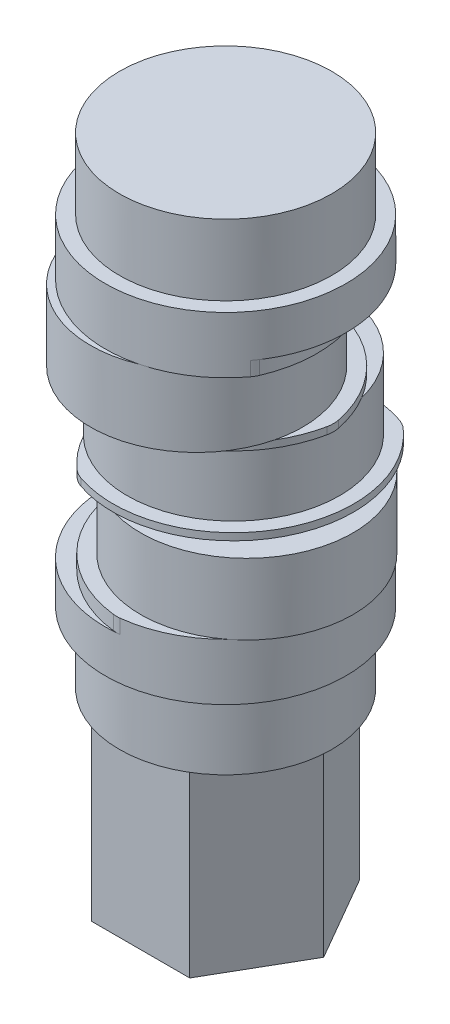
from build123d import *
from build123d.topology import SkipClean

# Parameters (mm, degrees)
BOSS_EXTRUDE1_DEPTH  = 13
SKETCH5_R            = 7.5
BOSS_EXTRUDE2_DEPTH  = 8
BOSS_EXTRUDE3_DEPTH  = 1
SKETCH7_R            = 7.5
BOSS_EXTRUDE4_DEPTH  = 5
BOSS_EXTRUDE5_DEPTH  = 0.5
SKETCH9_R            = 7.5
BOSS_EXTRUDE6_DEPTH  = 5
BOSS_EXTRUDE7_DEPTH  = 0.5
SKETCH12_R           = 7.5
BOSS_EXTRUDE8_DEPTH  = 5
BOSS_EXTRUDE9_DEPTH  = 1
SKETCH14_R           = 7.5
BOSS_EXTRUDE10_DEPTH = 8
FILLET1_R            = 2
BOSS_EXTRUDE11_START = 3
SKETCH15_R           = 8.5
BOSS_EXTRUDE11_DEPTH = 3
SKETCH16_R           = 8.5
BOSS_EXTRUDE12_DEPTH = 3


with BuildPart() as part:
    # Sketch4 → Boss-Extrude1 (new body)
    with BuildSketch(Plane(origin=(0, 0, 0), x_dir=(1, 0, 0), z_dir=(0, 1, 0))):
        Polygon((-3.464101615, 6), (-6.92820323, 0), (-3.464101615, -6), (3.464101615, -6), (6.92820323, 0), (3.464101615, 6), align=None)
    extrude(amount=BOSS_EXTRUDE1_DEPTH)

    # Sketch5 → Boss-Extrude2 (add)
    with BuildSketch(Plane(origin=(0, 13, 0), x_dir=(1, 0, 0), z_dir=(0, 1, 0))):
        Circle(SKETCH5_R)
    extrude(amount=BOSS_EXTRUDE2_DEPTH)

    # Sketch6 → Boss-Extrude3 (add)
    with BuildSketch(Plane(origin=(0, 21, 0), x_dir=(1, 0, 0), z_dir=(0, 1, 0))):
        with BuildLine():
            ThreePointArc((0.75, -8.466847111), (8.5, 0), (0.75, 8.466847111))
            ThreePointArc((0.75, 8.466847111), (-7, 0), (0.75, -8.466847111))
        make_face()
    extrude(amount=BOSS_EXTRUDE3_DEPTH)

    # Sketch7 → Boss-Extrude4 (add)
    with BuildSketch(Plane(origin=(0, 22, 0), x_dir=(1, 0, 0), z_dir=(0, 1, 0))):
        with Locations((1.5, 0)):
            Circle(SKETCH7_R)
    extrude(amount=BOSS_EXTRUDE4_DEPTH)

    # Sketch8 → Boss-Extrude5 (add)
    with BuildSketch(Plane(origin=(0, 27, 0), x_dir=(1, 0, 0), z_dir=(0, 1, 0))):
        with BuildLine():
            ThreePointArc((4.575074404, 7.924261316), (-5.861215932, 4.25), (-3.825074404, -6.625223211))
            ThreePointArc((-3.825074404, -6.625223211), (6.611215932, -2.950961894), (4.575074404, 7.924261316))
        make_face()
    extrude(amount=BOSS_EXTRUDE5_DEPTH)

    # Sketch9 → Boss-Extrude6 (add)
    with BuildSketch(Plane(origin=(0, 27.5, 0), x_dir=(1, 0, 0), z_dir=(0, 1, 0))):
        with Locations((-0.75, 1.299038106)):
            Circle(SKETCH9_R)
    extrude(amount=BOSS_EXTRUDE6_DEPTH)

    # Sketch11 → Boss-Extrude7 (add)
    with BuildSketch(Plane(origin=(0, 32.5, 0), x_dir=(1, 0, 0), z_dir=(0, 1, 0))):
        with BuildLine():
            ThreePointArc((-9.150148808, 0), (-0.75, -7.200961894), (7.650148808, 0))
            ThreePointArc((7.650148808, 0), (-0.75, 7.200961894), (-9.150148808, 0))
        make_face()
    extrude(amount=BOSS_EXTRUDE7_DEPTH)

    # Sketch12 → Boss-Extrude8 (add)
    with BuildSketch(Plane(origin=(0, 33, 0), x_dir=(1, 0, 0), z_dir=(0, 1, 0))):
        with Locations((-0.75, -1.299038106)):
            Circle(SKETCH12_R)
    extrude(amount=BOSS_EXTRUDE8_DEPTH)

    # Sketch13 → Boss-Extrude9 (add)
    with BuildSketch(Plane(origin=(0, 38, 0), x_dir=(1, 0, 0), z_dir=(0, 1, 0))):
        with BuildLine():
            ThreePointArc((6.957504688, -4.882942608), (3.5, 6.062177826), (-7.707504688, 3.583904503))
            ThreePointArc((-7.707504688, 3.583904503), (-4.25, -7.361215932), (6.957504688, -4.882942608))
        make_face()
    extrude(amount=BOSS_EXTRUDE9_DEPTH)

    # Sketch14 → Boss-Extrude10 (add)
    with BuildSketch(Plane(origin=(0, 39, 0), x_dir=(1, 0, 0), z_dir=(0, 1, 0))):
        Circle(SKETCH14_R)
    extrude(amount=BOSS_EXTRUDE10_DEPTH)

    # Fillet1
    fillet1_edges = [part.edges().sort_by_distance(p)[0] for p in [
        (0.75, 21.5, -8.466847111),
        (0.75, 21.5, 8.466847111),
        (-3.825074404, 27.25, 6.625223211),
        (4.575074404, 27.25, -7.924261316),
        (7.650148808, 32.75, 0),
        (-9.150148808, 32.75, 0),
        (-7.707504688, 38.5, -3.583904503),
        (6.957504688, 38.5, 4.882942608),
    ]]
    fillet(fillet1_edges, radius=FILLET1_R)

    # Sketch15 → Boss-Extrude11 (add)
    with BuildSketch(Plane.XZ.offset(-21).offset(BOSS_EXTRUDE11_START)):
        Circle(SKETCH15_R)
    extrude(amount=-BOSS_EXTRUDE11_DEPTH)

    # Sketch16 → Boss-Extrude12 (add)
    with SkipClean():  # the faces are left unmerged after this step: merging them gives an invalid solid
        with BuildSketch(Plane.XZ.offset(-39)):
            Circle(SKETCH16_R)
        extrude(amount=-BOSS_EXTRUDE12_DEPTH)


solid = part.part
